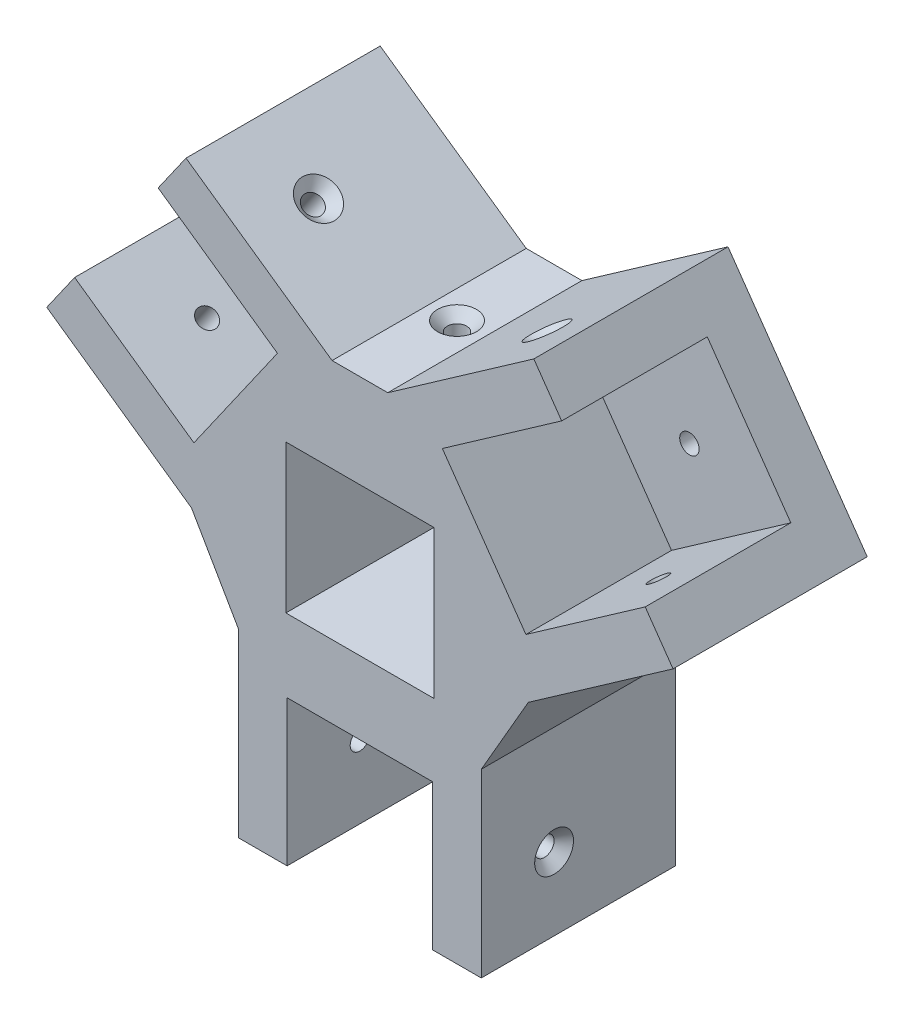
from build123d import *
from OCP.BRepFilletAPI import BRepFilletAPI_MakeChamfer

# Parameters (mm, degrees)
SKETCH1_W           = 30.5
SKETCH1_H           = 30.5
BOSS_EXTRUDE1_DEPTH = 10
SKETCH2_W           = 30.5
SKETCH2_H           = 30.5
BOSS_EXTRUDE2_DEPTH = 30
CHAMFER1_SIZE       = 10
CHAMFER1_SIZE2      = 11.831007916
SKETCH3_R           = 2
CUT_EXTRUDE1_DEPTH  = 94.224303623
SKETCH4_R           = 2
CUT_EXTRUDE2_DEPTH  = 120.721978802
SKETCH5_R           = 2
CUT_EXTRUDE3_DEPTH  = 30
SKETCH6_R           = 2
CUT_EXTRUDE4_DEPTH  = 122.429059078
CHAMFER3_SIZE       = 2


with BuildPart() as part:
    # Sketch1 → Boss-Extrude1 (new body)
    with BuildSketch(Plane.XY):
        Polygon((-25, -60.25), (-25, -13.014176264), (-64.503552507, 14.646508987), (-35.824730689, 55.604111202), (0, 30.519364719), (35.824730689, 55.604111202), (64.503552507, 14.646508987), (25, -13.014176264), (25, -60.25), align=None)
        Rectangle(SKETCH1_W, SKETCH1_H, mode=Mode.SUBTRACT)
    extrude(amount=BOSS_EXTRUDE1_DEPTH)

    # Sketch2 → Boss-Extrude2 (add)
    with BuildSketch(Plane.XY.offset(10)):
        Polygon((-58.767788143, 22.83802943), (-34.193226815, 5.63073634), (-16.985933724, 30.205297668), (-41.560495053, 47.412590759), (-35.824730689, 55.604111202), (0, 30.519364719), (35.824730689, 55.604111202), (41.560495053, 47.412590759), (16.985933724, 30.205297668), (34.193226815, 5.63073634), (58.767788143, 22.83802943), (64.503552507, 14.646508987), (25, -13.014176264), (25, -60.25), (15, -60.25), (15, -30.25), (-15, -30.25), (-15, -60.25), (-25, -60.25), (-25, -13.014176264), (-64.503552507, 14.646508987), align=None)
        Rectangle(SKETCH2_W, SKETCH2_H, mode=Mode.SUBTRACT)
    extrude(amount=BOSS_EXTRUDE2_DEPTH)

    # Chamfer1: one chamfer whose edges measure the first distance from different faces: ONE call of the kernel's chamfer builder (chamfer() names one face for all edges)
    chamfer1_edges_1 = [part.edges().sort_by_distance(p)[0] for p in [
        (-25, -13.014176264, 20),
    ]]
    chamfer1_side_1 = [part.faces().sort_by_distance(p)[0] for p in [
        (-25, -36.632088132, 20),
    ]]
    chamfer1_edges_2 = [part.edges().sort_by_distance(p)[0] for p in [
        (25, -13.014176264, 20),
    ]]
    chamfer1_side_2 = [part.faces().sort_by_distance(p)[0] for p in [
        (25, -36.632088132, 20),
    ]]
    chamfer1 = BRepFilletAPI_MakeChamfer(part.part.solid().wrapped)
    for e in chamfer1_edges_1:
        chamfer1.Add(CHAMFER1_SIZE, CHAMFER1_SIZE2, e.wrapped, chamfer1_side_1[0].wrapped)  # the first distance lies on this face
    for e in chamfer1_edges_2:
        chamfer1.Add(CHAMFER1_SIZE, CHAMFER1_SIZE2, e.wrapped, chamfer1_side_2[0].wrapped)  # the first distance lies on this face
    add(Compound.cast(chamfer1.Shape()), mode=Mode.REPLACE)

    # Chamfer2
    # the kernel refuses this chamfer: 10 mm, written as the material it adds along each edge
    with BuildSketch(Plane(origin=(0, 30.519364719, 40), x_dir=(0.8366959699781049, 0.5476676490558834, 0), z_dir=(0, 0, -1))) as chamfer2_piece_1:
        with BuildLine():
            Line((7.333326063, 0), (-2.934212568, -6.720719288))
            Line((-2.934212568, -6.720719288), (-3.119919002, -6.646468897))
            ThreePointArc((-3.119919002, -6.646468897), (-1.546295883, -3.328697528), (-0.185706433, 0.074250391))
            Line((-0.185706433, 0.074250391), (0.006257204, 0.199902095))
            ThreePointArc((0.006257204, 0.199902095), (3.669331251, 0.085242964), (7.339583267, 0.199902095))
            Line((7.339583267, 0.199902095), (7.333326063, 0))
        make_face()
    extrude(amount=40)

    # Sketch3 → Cut-Extrude1 (cut, through all)
    with BuildSketch(Plane.XY.offset(10)):
        with Locations((37.876860934, 26.521663549)):
            Circle(SKETCH3_R)
        with Locations((0, -45.25)):
            Circle(SKETCH3_R)
        with Locations((-37.876860934, 26.521663549)):
            Circle(SKETCH3_R)
    extrude(amount=-CUT_EXTRUDE1_DEPTH, mode=Mode.SUBTRACT)

    # Sketch4 → Cut-Extrude2 (cut, through all)
    with BuildSketch(Plane(origin=(-14.339410909, 20.478801107, 0), x_dir=(0.819152044288991, 0.5735764363510474, 0), z_dir=(-0.5735764363510474, 0.819152044288991, 0))):
        with Locations(Location((46.23910933, -25, 0), (0, 0, 180))):
            Circle(SKETCH4_R)
    cut_extrude2 = extrude(amount=-CUT_EXTRUDE2_DEPTH, mode=Mode.SUBTRACT)

    # Sketch5 → Cut-Extrude3 (cut)
    with BuildSketch(Plane(origin=(25, 0, 0), x_dir=(0, 0, -1), z_dir=(1, 0, 0))):
        with Locations(Location((-25, -45.25, 0), (0, 0, 90))):
            Circle(SKETCH5_R)
    cut_extrude3 = extrude(amount=-CUT_EXTRUDE3_DEPTH, mode=Mode.SUBTRACT)

    # Mirror1: Cut-Extrude2, Cut-Extrude3 across plane
    add(cut_extrude2.mirror(Plane(origin=(0, 0, 0), x_dir=(0, 0, 1), z_dir=(1, 0, 0))), mode=Mode.SUBTRACT)
    add(cut_extrude3.mirror(Plane(origin=(0, 0, 0), x_dir=(0, 0, 1), z_dir=(1, 0, 0))), mode=Mode.SUBTRACT)

    # Sketch6 → Cut-Extrude4 (cut, through all)
    with BuildSketch(Plane(origin=(0, 34.535590164, 0), x_dir=(1, 0, 0), z_dir=(0, 1, 0))):
        with Locations(Location((0, -20, 0), (0, 0, 270))):
            Circle(SKETCH6_R)
    extrude(amount=-CUT_EXTRUDE4_DEPTH, mode=Mode.SUBTRACT)

    # Chamfer3
    chamfer3_edges = [part.edges().sort_by_distance(p)[0] for p in [
        (35.876860934, 26.521663549, 0),
        (-2, -45.25, 0),
        (-39.876860934, 26.521663549, 0),
        (53.854575931, 7.190015315, 25),
        (25.175754113, 48.147617529, 25),
        (25, -47.25, 25),
        (-25.175754113, 48.147617529, 25),
        (-53.854575931, 7.190015315, 25),
        (-25, -47.25, 25),
        (0, -30.25, 18),
        (0, 34.535590164, 18),
    ]]
    chamfer(chamfer3_edges, length=CHAMFER3_SIZE)


solid = part.part
